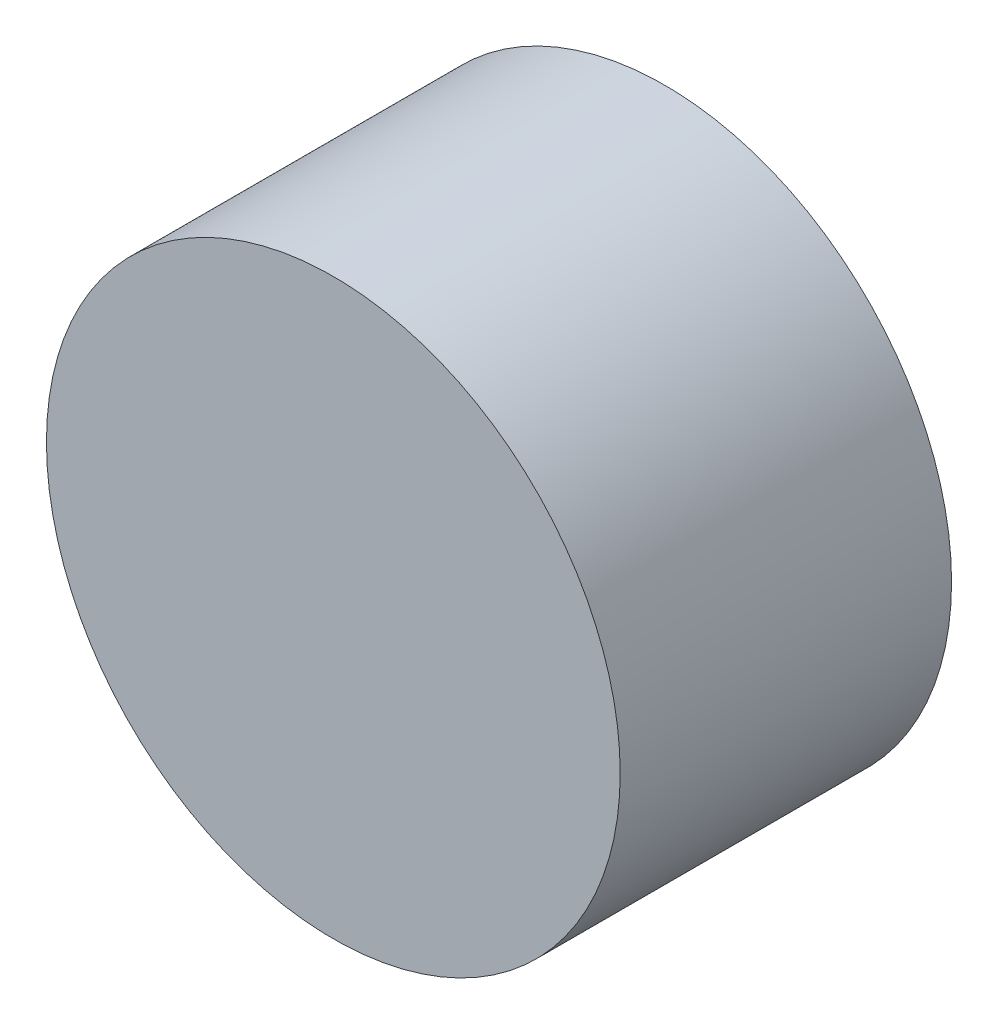
from build123d import *

# Parameters (mm, degrees)
SKETCH1_R           = 25.4
BOSS_EXTRUDE1_DEPTH = 29.337


with BuildPart() as part:
    # Sketch1 → Boss-Extrude1 (new body)
    with BuildSketch(Plane.XY):
        Circle(SKETCH1_R)
    extrude(amount=BOSS_EXTRUDE1_DEPTH)


solid = part.part
